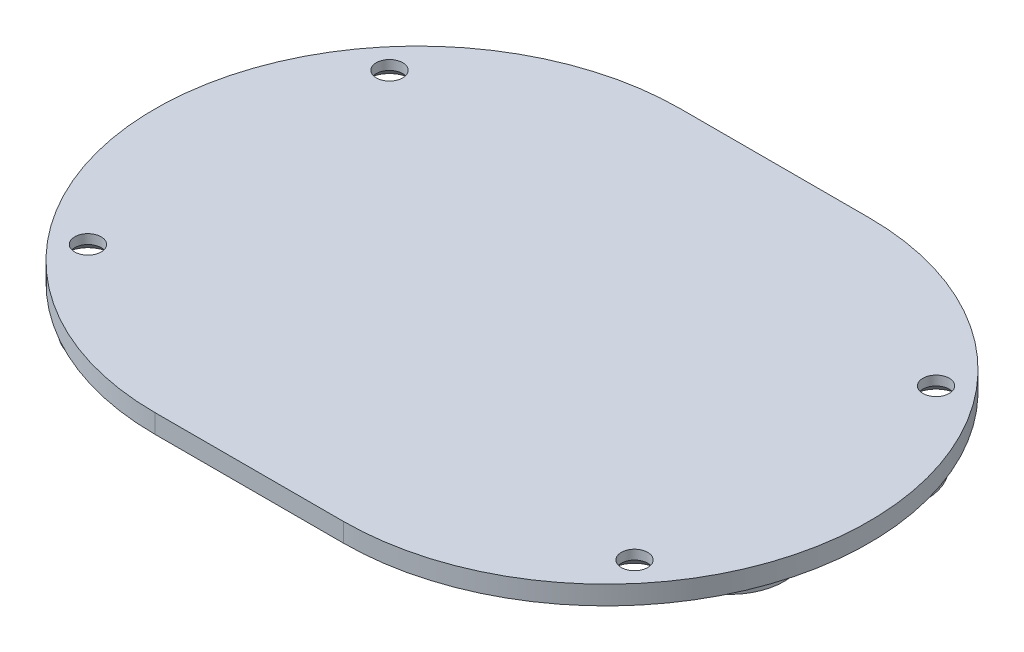
from build123d import *

# Parameters (mm, degrees)
BOSS_EXTRUDE1_DEPTH                                  = 2
CSK_FOR_ST2_2_CROSS_RECESSED_CTSK_HEAD_T_D           = 2.8
CSK_FOR_ST2_2_CROSS_RECESSED_CTSK_HEAD_T_DEPTH       = 7.5
CSK_FOR_ST2_2_CROSS_RECESSED_CTSK_HEAD_T_CSINK_D     = 4.8
CSK_FOR_ST2_2_CROSS_RECESSED_CTSK_HEAD_T_CSINK_ANGLE = 90
CSK_FOR_ST2_2_CROSS_RECESSED_CTSK_HEAD_T_TIP         = 0.841204867
SKETCH4_R                                            = 5.75
SKETCH4_R_2                                          = 4.25
EXTRUDE_THIN1_DEPTH                                  = 0.5


with BuildPart() as part:
    # Sketch1 → Boss-Extrude1 (new body)
    with BuildSketch(Plane.XZ.offset(-2)):
        with BuildLine():
            Line((0, -27.9), (20, -27.9))
            ThreePointArc((20, -27.9), (47.9, 0), (20, 27.9))
            Line((20, 27.9), (0, 27.9))
            ThreePointArc((0, 27.9), (-27.9, 0), (0, -27.9))
        make_face()
    extrude(amount=BOSS_EXTRUDE1_DEPTH)

    # CSK for ST2.2 Cross recessed CTSK head tapping screws1
    with Locations(Plane(origin=(0, 0, 0), x_dir=(-1, 0, 0), z_dir=(0, -1, 0))):
        with Locations((-39, 16), (-39, -16), (19, -16), (19, 16)):
            CounterSinkHole(CSK_FOR_ST2_2_CROSS_RECESSED_CTSK_HEAD_T_D / 2, CSK_FOR_ST2_2_CROSS_RECESSED_CTSK_HEAD_T_CSINK_D / 2, depth=CSK_FOR_ST2_2_CROSS_RECESSED_CTSK_HEAD_T_DEPTH, counter_sink_angle=CSK_FOR_ST2_2_CROSS_RECESSED_CTSK_HEAD_T_CSINK_ANGLE)
            with Locations((0, 0, -(CSK_FOR_ST2_2_CROSS_RECESSED_CTSK_HEAD_T_DEPTH + CSK_FOR_ST2_2_CROSS_RECESSED_CTSK_HEAD_T_TIP / 2))):  # 118° drill point
                Cone(0, CSK_FOR_ST2_2_CROSS_RECESSED_CTSK_HEAD_T_D / 2, CSK_FOR_ST2_2_CROSS_RECESSED_CTSK_HEAD_T_TIP, mode=Mode.SUBTRACT)

    # Sketch4 → Extrude-Thin1 (add)
    # profile 1 of 4: a face of its own
    with BuildSketch(Plane.XZ):
        with Locations((-11, 19.052558883)):
            Circle(SKETCH4_R)
        with Locations((-11, 19.052558883)):
            Circle(SKETCH4_R_2, mode=Mode.SUBTRACT)
    # profile 2 of 4: a face of its own
    with BuildSketch(Plane.XZ):
        with Locations((-11, -19.052558883)):
            Circle(SKETCH4_R)
        with Locations((-11, -19.052558883)):
            Circle(SKETCH4_R_2, mode=Mode.SUBTRACT)
    # profile 3 of 4: a face of its own
    with BuildSketch(Plane.XZ):
        with Locations((40.673237657, 7.524443153)):
            Circle(SKETCH4_R)
        with Locations((40.673237657, 7.524443153)):
            Circle(SKETCH4_R_2, mode=Mode.SUBTRACT)
    # profile 4 of 4: a face of its own
    with BuildSketch(Plane.XZ):
        with Locations((40.673237657, -7.524443153)):
            Circle(SKETCH4_R)
        with Locations((40.673237657, -7.524443153)):
            Circle(SKETCH4_R_2, mode=Mode.SUBTRACT)
    extrude(amount=EXTRUDE_THIN1_DEPTH)


solid = part.part
